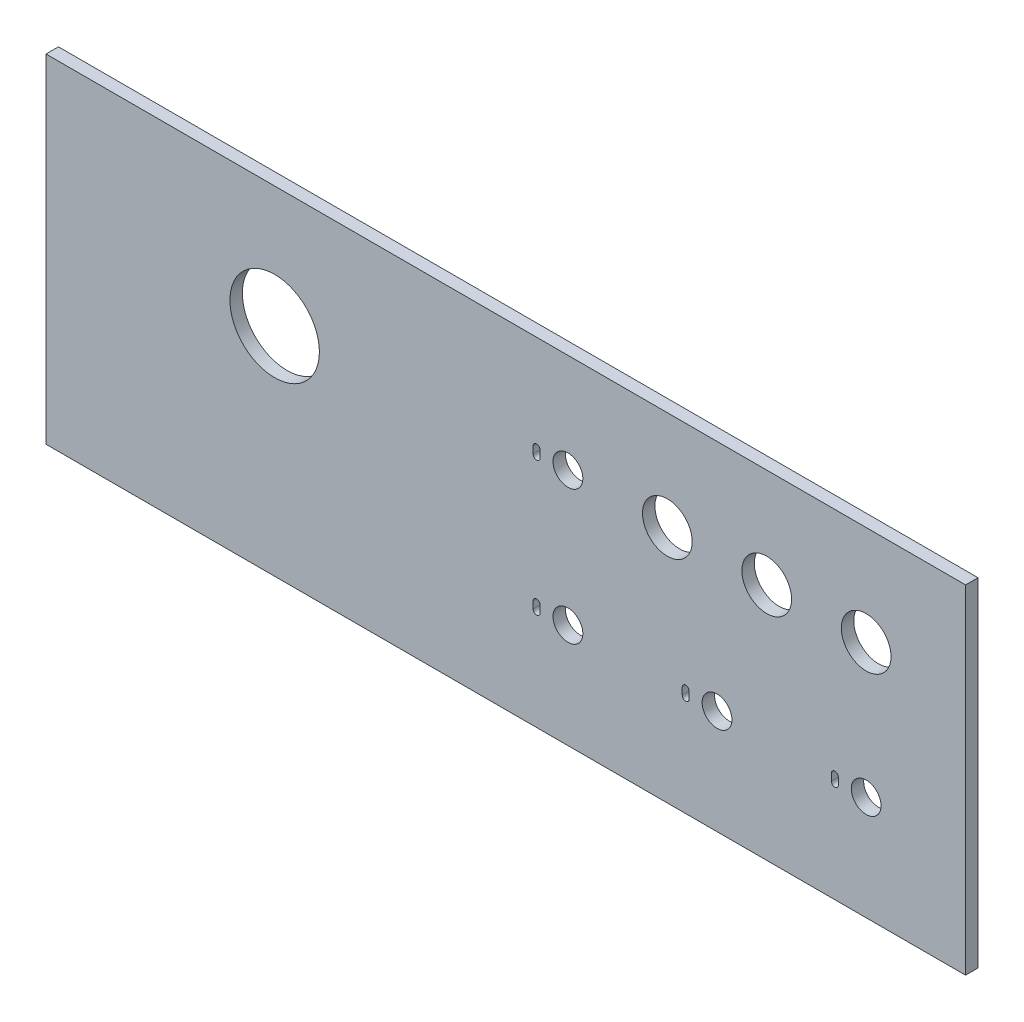
from build123d import *

# Parameters (mm, degrees)
SKETCH1_W          = 234.95
SKETCH1_H          = 86.36
BASE_FLANGE1_DEPTH = 3.175
SKETCH11_R         = 6.35
CUT_EXTRUDE3_DEPTH = 126.199715056
SKETCH12_R         = 3.81
CUT_EXTRUDE4_DEPTH = 126.199715056
SKETCH13_R         = 11.43
CUT_EXTRUDE5_DEPTH = 126.199715056
SKETCH14_R         = 3.81
CUT_EXTRUDE6_DEPTH = 126.199715056


# Sheet-metal steps are written as plain solids
with BuildPart() as part:
    # Sketch1 → Base-Flange1 (new body)
    with BuildSketch(Plane.XY):
        Rectangle(SKETCH1_W, SKETCH1_H)
    extrude(amount=-BASE_FLANGE1_DEPTH)

    # Sketch11 → Cut-Extrude3 (cut, through all)
    with BuildSketch(Plane.XY):
        with Locations((41.275, 17.78)):
            Circle(SKETCH11_R)
        with Locations((66.675, 17.78)):
            Circle(SKETCH11_R)
        with Locations((92.075, 17.78)):
            Circle(SKETCH11_R)
    extrude(amount=-CUT_EXTRUDE3_DEPTH, mode=Mode.SUBTRACT)

    # Sketch12 → Cut-Extrude4 (cut, through all)
    with BuildSketch(Plane.XY):
        with Locations((92.075, -16.51)):
            Circle(SKETCH12_R)
        with Locations((53.975, -16.51)):
            Circle(SKETCH12_R)
        with Locations((15.875, -16.51)):
            Circle(SKETCH12_R)
        with BuildLine():
            Line((8.763, -15.621), (8.763, -17.399))
            ThreePointArc((8.763, -17.399), (7.874, -18.288), (6.985, -17.399))
            Line((6.985, -17.399), (6.985, -15.621))
            ThreePointArc((6.985, -15.621), (7.874, -14.732), (8.763, -15.621))
        make_face()
        with BuildLine():
            Line((46.863, -15.621), (46.863, -17.399))
            ThreePointArc((46.863, -17.399), (45.974, -18.288), (45.085, -17.399))
            Line((45.085, -17.399), (45.085, -15.621))
            ThreePointArc((45.085, -15.621), (45.974, -14.732), (46.863, -15.621))
        make_face()
        with BuildLine():
            Line((84.963, -15.621), (84.963, -17.399))
            ThreePointArc((84.963, -17.399), (84.074, -18.288), (83.185, -17.399))
            Line((83.185, -17.399), (83.185, -15.621))
            ThreePointArc((83.185, -15.621), (84.074, -14.732), (84.963, -15.621))
        make_face()
    extrude(amount=-CUT_EXTRUDE4_DEPTH, mode=Mode.SUBTRACT)

    # Sketch13 → Cut-Extrude5 (cut, through all)
    with BuildSketch(Plane.XY):
        with Locations((-59.055, 12.192)):
            Circle(SKETCH13_R)
    extrude(amount=-CUT_EXTRUDE5_DEPTH, mode=Mode.SUBTRACT)

    # Sketch14 → Cut-Extrude6 (cut, through all)
    with BuildSketch(Plane.XY):
        with Locations((15.875, 17.78)):
            Circle(SKETCH14_R)
        with BuildLine():
            Line((8.763, 18.669), (8.763, 16.891))
            ThreePointArc((8.763, 16.891), (7.874, 16.002), (6.985, 16.891))
            Line((6.985, 16.891), (6.985, 18.669))
            ThreePointArc((6.985, 18.669), (7.874, 19.558), (8.763, 18.669))
        make_face()
    extrude(amount=-CUT_EXTRUDE6_DEPTH, mode=Mode.SUBTRACT)


solid = part.part
